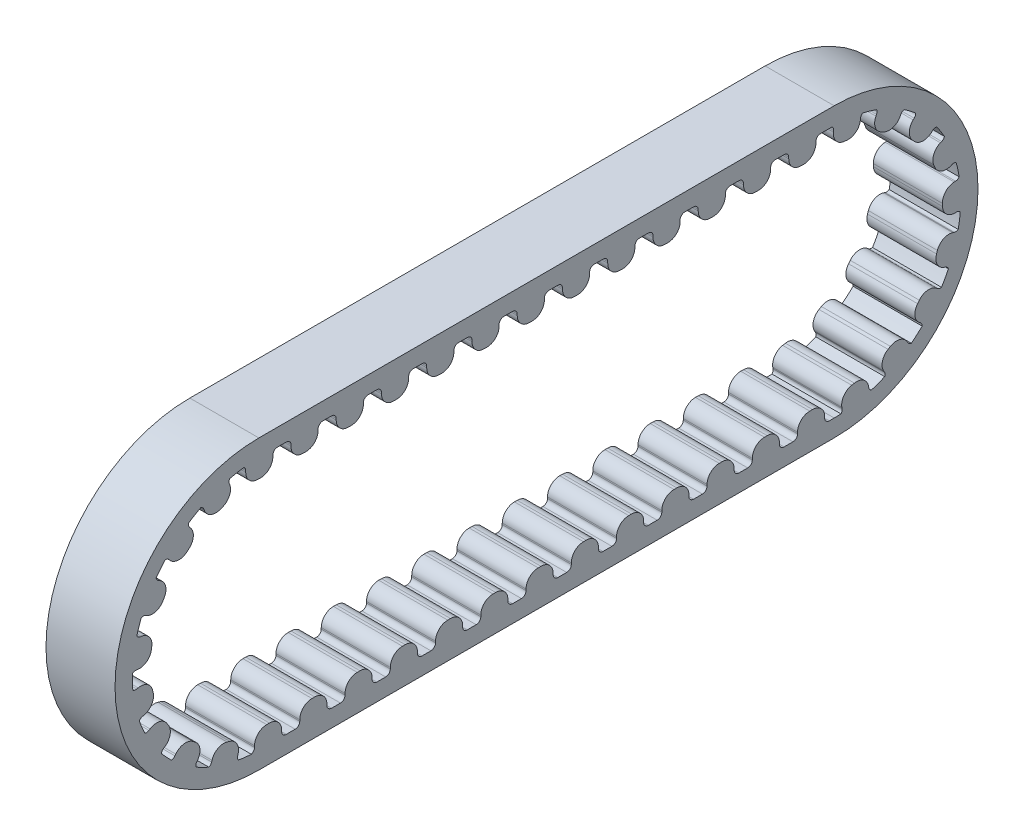
from build123d import *

# Parameters (mm, degrees)
BOSS_EXTRUDE1_DEPTH = 3
BOSS_EXTRUDE2_DEPTH = 3
CRVPATTERN1_DEPTH   = 3


# Read off the part's stored shape, not the designer's step: CrvPattern1
with BuildPart() as part:
    # Sketch1 → Boss-Extrude1 (new body)
    with BuildSketch(Plane(origin=(0, 0, 0), x_dir=(0, 0, -1), z_dir=(1, 0, 0))):
        with BuildLine():
            Line((0, 6.25), (25, 6.25))
            ThreePointArc((25, 6.25), (31.25, 0), (25, -6.25))
            Line((25, -6.25), (0, -6.25))
            ThreePointArc((0, -6.25), (-6.25, 0), (0, 6.25))
        make_face()
        with BuildLine():
            Line((0, 5.5), (25, 5.5))
            ThreePointArc((25, 5.5), (30.5, 0), (25, -5.5))
            Line((25, -5.5), (0, -5.5))
            ThreePointArc((0, -5.5), (-5.5, 0), (0, 5.5))
        make_face(mode=Mode.SUBTRACT)
    extrude(amount=BOSS_EXTRUDE1_DEPTH)

    # Sketch2 → Boss-Extrude2 (add)
    with BuildSketch(Plane(origin=(3, 0, 0), x_dir=(0, 0, -1), z_dir=(1, 0, 0))):
        with BuildLine():
            Line((1.39472131, 5.3), (1.39472131, 5.24))
            ThreePointArc((1.39472131, 5.24), (1.549954716, 4.865233406), (1.92472131, 4.71))
            Line((1.92472131, 4.71), (2.04472131, 4.71))
            ThreePointArc((2.04472131, 4.71), (2.419487904, 4.865233406), (2.57472131, 5.24))
            Line((2.57472131, 5.24), (2.57472131, 5.3))
            ThreePointArc((2.57472131, 5.3), (2.633299954, 5.441421356), (2.77472131, 5.5))
            ThreePointArc((2.77472131, 5.5), (1.98472131, 5.544721429), (1.19472131, 5.5))
            ThreePointArc((1.19472131, 5.5), (1.336142666, 5.441421356), (1.39472131, 5.3))
        make_face()
    extrude(amount=-BOSS_EXTRUDE2_DEPTH)

    # CrvPattern1 outline → CrvPattern1 (add)
    with BuildSketch(Plane.YZ):
        with BuildLine():
            ThreePointArc((5.24, 0.571732625), (4.865233406, 0.416499219), (4.71, 0.041732625))
            Line((4.71, 0.041732625), (4.71, -0.078267375))
            ThreePointArc((4.71, -0.078267375), (4.865233406, -0.453033969), (5.24, -0.608267375))
            Line((5.24, -0.608267375), (5.3, -0.608267375))
            ThreePointArc((5.3, -0.608267375), (5.441421356, -0.666846019), (5.5, -0.808267375))
            Line((5.5, -0.808267375), (5.5, 0))
            ThreePointArc((5.5, 0), (5.490260449, 0.327169987), (5.461076291, 0.65318125))
            ThreePointArc((5.461076291, 0.65318125), (5.390248892, 0.593252549), (5.3, 0.571732625))
            Line((5.3, 0.571732625), (5.24, 0.571732625))
        make_face()
        with BuildLine():
            ThreePointArc((5.3, -4.541175245), (5.441421357, -4.599753888), (5.5, -4.741175245))
            Line((5.5, -4.741175245), (5.5, -3.161175245))
            ThreePointArc((5.5, -3.161175245), (5.441421356, -3.302596601), (5.3, -3.361175245))
            Line((5.3, -3.361175245), (5.24, -3.361175245))
            ThreePointArc((5.24, -3.361175245), (4.865233406, -3.516408651), (4.71, -3.891175245))
            Line((4.71, -3.891175245), (4.71, -4.011175245))
            ThreePointArc((4.71, -4.011175245), (4.865233406, -4.385941839), (5.24, -4.541175245))
            Line((5.24, -4.541175245), (5.3, -4.541175245))
        make_face()
        with BuildLine():
            ThreePointArc((5.3, -6.507629179), (5.441421356, -6.566207823), (5.5, -6.707629179))
            Line((5.5, -6.707629179), (5.5, -5.127629179))
            ThreePointArc((5.5, -5.127629179), (5.441421357, -5.269050536), (5.3, -5.327629179))
            Line((5.3, -5.327629179), (5.24, -5.327629179))
            ThreePointArc((5.24, -5.327629179), (4.865233406, -5.482862585), (4.71, -5.857629179))
            Line((4.71, -5.857629179), (4.71, -5.977629179))
            ThreePointArc((4.71, -5.977629179), (4.865233406, -6.352395773), (5.24, -6.507629179))
            Line((5.24, -6.507629179), (5.3, -6.507629179))
        make_face()
        with BuildLine():
            ThreePointArc((5.3, -8.474083114), (5.441421356, -8.532661758), (5.5, -8.674083114))
            Line((5.5, -8.674083114), (5.5, -7.094083114))
            ThreePointArc((5.5, -7.094083114), (5.441421356, -7.23550447), (5.3, -7.294083114))
            Line((5.3, -7.294083114), (5.24, -7.294083114))
            ThreePointArc((5.24, -7.294083114), (4.865233406, -7.44931652), (4.71, -7.824083114))
            Line((4.71, -7.824083114), (4.71, -7.944083114))
            ThreePointArc((4.71, -7.944083114), (4.865233406, -8.318849708), (5.24, -8.474083114))
            Line((5.24, -8.474083114), (5.3, -8.474083114))
        make_face()
        with BuildLine():
            ThreePointArc((5.3, -10.440537049), (5.441421357, -10.499115693), (5.5, -10.640537049))
            Line((5.5, -10.640537049), (5.5, -9.060537049))
            ThreePointArc((5.5, -9.060537049), (5.441421356, -9.201958405), (5.3, -9.260537049))
            Line((5.3, -9.260537049), (5.24, -9.260537049))
            ThreePointArc((5.24, -9.260537049), (4.865233406, -9.415770455), (4.71, -9.790537049))
            Line((4.71, -9.790537049), (4.71, -9.910537049))
            ThreePointArc((4.71, -9.910537049), (4.865233406, -10.285303643), (5.24, -10.440537049))
            Line((5.24, -10.440537049), (5.3, -10.440537049))
        make_face()
        with BuildLine():
            ThreePointArc((5.3, -12.406990983), (5.441421356, -12.465569627), (5.5, -12.606990983))
            Line((5.5, -12.606990983), (5.5, -11.026990983))
            ThreePointArc((5.5, -11.026990983), (5.441421356, -11.168412339), (5.3, -11.226990983))
            Line((5.3, -11.226990983), (5.24, -11.226990983))
            ThreePointArc((5.24, -11.226990983), (4.865233406, -11.382224389), (4.71, -11.756990983))
            Line((4.71, -11.756990983), (4.71, -11.876990983))
            ThreePointArc((4.71, -11.876990983), (4.865233406, -12.251757577), (5.24, -12.406990983))
            Line((5.24, -12.406990983), (5.3, -12.406990983))
        make_face()
        with BuildLine():
            ThreePointArc((5.3, -14.373444918), (5.441421356, -14.432023562), (5.5, -14.573444918))
            Line((5.5, -14.573444918), (5.5, -12.993444918))
            ThreePointArc((5.5, -12.993444918), (5.441421356, -13.134866274), (5.3, -13.193444918))
            Line((5.3, -13.193444918), (5.24, -13.193444918))
            ThreePointArc((5.24, -13.193444918), (4.865233406, -13.348678324), (4.71, -13.723444918))
            Line((4.71, -13.723444918), (4.71, -13.843444918))
            ThreePointArc((4.71, -13.843444918), (4.865233406, -14.218211512), (5.24, -14.373444918))
            Line((5.24, -14.373444918), (5.3, -14.373444918))
        make_face()
        with BuildLine():
            ThreePointArc((5.3, -16.339898853), (5.441421356, -16.398477496), (5.5, -16.539898853))
            Line((5.5, -16.539898853), (5.5, -14.959898853))
            ThreePointArc((5.5, -14.959898853), (5.441421356, -15.101320209), (5.3, -15.159898853))
            Line((5.3, -15.159898853), (5.24, -15.159898853))
            ThreePointArc((5.24, -15.159898853), (4.865233405, -15.315132259), (4.71, -15.689898853))
            Line((4.71, -15.689898853), (4.71, -15.809898853))
            ThreePointArc((4.71, -15.809898853), (4.865233406, -16.184665447), (5.24, -16.339898853))
            Line((5.24, -16.339898853), (5.3, -16.339898853))
        make_face()
        with BuildLine():
            ThreePointArc((5.3, -18.306352787), (5.441421356, -18.364931431), (5.5, -18.506352787))
            Line((5.5, -18.506352787), (5.5, -16.926352787))
            ThreePointArc((5.5, -16.926352787), (5.441421356, -17.067774143), (5.3, -17.126352787))
            Line((5.3, -17.126352787), (5.24, -17.126352787))
            ThreePointArc((5.24, -17.126352787), (4.865233406, -17.281586193), (4.71, -17.656352787))
            Line((4.71, -17.656352787), (4.71, -17.776352787))
            ThreePointArc((4.71, -17.776352787), (4.865233406, -18.151119381), (5.24, -18.306352787))
            Line((5.24, -18.306352787), (5.3, -18.306352787))
        make_face()
        with BuildLine():
            ThreePointArc((5.3, -20.272806722), (5.441421356, -20.331385366), (5.5, -20.472806722))
            Line((5.5, -20.472806722), (5.5, -18.892806722))
            ThreePointArc((5.5, -18.892806722), (5.441421356, -19.034228078), (5.3, -19.092806722))
            Line((5.3, -19.092806722), (5.24, -19.092806722))
            ThreePointArc((5.24, -19.092806722), (4.865233406, -19.248040128), (4.71, -19.622806722))
            Line((4.71, -19.622806722), (4.71, -19.742806722))
            ThreePointArc((4.71, -19.742806722), (4.865233406, -20.117573316), (5.24, -20.272806722))
            Line((5.24, -20.272806722), (5.3, -20.272806722))
        make_face()
        with BuildLine():
            ThreePointArc((5.3, -22.239260656), (5.441421356, -22.2978393), (5.5, -22.439260656))
            Line((5.5, -22.439260656), (5.5, -20.859260656))
            ThreePointArc((5.5, -20.859260656), (5.441421356, -21.000682013), (5.3, -21.059260656))
            Line((5.3, -21.059260656), (5.24, -21.059260656))
            ThreePointArc((5.24, -21.059260656), (4.865233406, -21.214494062), (4.71, -21.589260656))
            Line((4.71, -21.589260656), (4.71, -21.709260656))
            ThreePointArc((4.71, -21.709260656), (4.865233406, -22.08402725), (5.24, -22.239260656))
            Line((5.24, -22.239260656), (5.3, -22.239260656))
        make_face()
        with BuildLine():
            ThreePointArc((5.3, -24.205714591), (5.441421356, -24.264293235), (5.5, -24.405714591))
            Line((5.5, -24.405714591), (5.5, -22.825714591))
            ThreePointArc((5.5, -22.825714591), (5.441421356, -22.967135947), (5.3, -23.025714591))
            Line((5.3, -23.025714591), (5.24, -23.025714591))
            ThreePointArc((5.24, -23.025714591), (4.865233406, -23.180947997), (4.71, -23.555714591))
            Line((4.71, -23.555714591), (4.71, -23.675714591))
            ThreePointArc((4.71, -23.675714591), (4.865233406, -24.050481185), (5.24, -24.205714591))
            Line((5.24, -24.205714591), (5.3, -24.205714591))
        make_face()
        with BuildLine():
            ThreePointArc((5.208002927, -26.146649691), (5.294135665, -26.176726755), (5.357948372, -26.241929643))
            ThreePointArc((5.357948372, -26.241929643), (5.464371695, -25.625013581), (5.5, -25))
            Line((5.5, -25), (5.5, -24.910850522))
            ThreePointArc((5.5, -24.910850522), (5.423687661, -24.961765723), (5.332671436, -24.973253866))
            Line((5.332671436, -24.973253866), (5.273007241, -24.966914789))
            ThreePointArc((5.273007241, -24.966914789), (4.883937517, -25.081684822), (4.689978345, -25.43795333))
            Line((4.689978345, -25.43795333), (4.677300192, -25.557281719))
            ThreePointArc((4.677300192, -25.557281719), (4.792070224, -25.946351443), (5.148338732, -26.140310615))
            Line((5.148338732, -26.140310615), (5.208002927, -26.146649691))
        make_face()
        with BuildLine():
            ThreePointArc((4.47736635, -27.896772439), (4.547526179, -27.955091191), (4.584484541, -28.038503167))
            ThreePointArc((4.584484541, -28.038503167), (4.919993096, -27.458387262), (5.182457978, -26.841773413))
            ThreePointArc((5.182457978, -26.841773413), (5.093564112, -26.86230044), (5.004802163, -26.841210284))
            Line((5.004802163, -26.841210284), (4.951129511, -26.814391514))
            ThreePointArc((4.951129511, -26.814391514), (4.546498077, -26.785741671), (4.240121949, -27.051600804))
            Line((4.240121949, -27.051600804), (4.186484409, -27.158946107))
            ThreePointArc((4.186484409, -27.158946107), (4.157834566, -27.56357754), (4.423693698, -27.869953669))
            Line((4.423693698, -27.869953669), (4.47736635, -27.896772439))
        make_face()
        with BuildLine():
            ThreePointArc((3.180446875, -29.280520724), (3.225760205, -29.359705195), (3.231189847, -29.450776581))
            ThreePointArc((3.231189847, -29.450776581), (3.748503458, -29.024763574), (4.210165676, -28.538997736))
            ThreePointArc((4.210165676, -28.538997736), (4.11970951, -28.527116647), (4.043941606, -28.476296346))
            Line((4.043941606, -28.476296346), (4.003048841, -28.432389835))
            ThreePointArc((4.003048841, -28.432389835), (3.634032181, -28.263943657), (3.253988563, -28.405768405))
            Line((3.253988563, -28.405768405), (3.16617554, -28.487553935))
            ThreePointArc((3.16617554, -28.487553935), (2.997729362, -28.856570595), (3.13955411, -29.236614213))
            Line((3.13955411, -29.236614213), (3.180446875, -29.280520724))
        make_face()
        with BuildLine():
            ThreePointArc((1.481274707, -30.122882513), (1.496010453, -30.212917707), (1.469224651, -30.300130086))
            ThreePointArc((1.469224651, -30.300130086), (2.102915155, -30.082100732), (2.705385158, -29.788621007))
            ThreePointArc((2.705385158, -29.788621007), (2.624807297, -29.745834484), (2.571616319, -29.671711625))
            Line((2.571616319, -29.671711625), (2.548675426, -29.616270526))
            ThreePointArc((2.548675426, -29.616270526), (2.261945579, -29.329332545), (1.856301168, -29.329185371))
            Line((1.856301168, -29.329185371), (1.74541897, -29.375067156))
            ThreePointArc((1.74541897, -29.375067156), (1.458480988, -29.661797002), (1.458333815, -30.067441414))
            Line((1.458333815, -30.067441414), (1.481274707, -30.122882513))
        make_face()
        with BuildLine():
            ThreePointArc((-0.405244323, -30.317318595), (-0.42294989, -30.406817149), (-0.478563354, -30.47914018))
            ThreePointArc((-0.478563354, -30.47914018), (0.191356906, -30.496670131), (0.858436225, -30.432594891))
            ThreePointArc((0.858436225, -30.432594891), (0.797927897, -30.364314435), (0.774041269, -30.27626384))
            Line((0.774041269, -30.27626384), (0.771953739, -30.216300166))
            ThreePointArc((0.771953739, -30.216300166), (0.603775375, -29.847161374), (0.22383477, -29.705060892))
            Line((0.22383477, -29.705060892), (0.103907422, -29.709235952))
            ThreePointArc((0.103907422, -29.709235952), (-0.265231371, -29.877414316), (-0.407331853, -30.257354921))
            Line((-0.407331853, -30.257354921), (-0.405244323, -30.317318595))
        make_face()
        with BuildLine():
            ThreePointArc((-2.240509354, -29.839237319), (-2.288416891, -29.916879745), (-2.365824205, -29.965166244))
            ThreePointArc((-2.365824205, -29.965166244), (-1.744403549, -30.216038368), (-1.097084962, -30.389471643))
            ThreePointArc((-1.097084962, -30.389471643), (-1.129870857, -30.304333148), (-1.121432031, -30.213491172))
            Line((-1.121432031, -30.213491172), (-1.102402175, -30.156588935))
            ThreePointArc((-1.102402175, -30.156588935), (-1.130758397, -29.751936819), (-1.43694153, -29.485855441))
            Line((-1.43694153, -29.485855441), (-1.550746003, -29.447795727))
            ThreePointArc((-1.550746003, -29.447795727), (-1.955398119, -29.47615195), (-2.221479497, -29.782335083))
            Line((-2.221479497, -29.782335083), (-2.240509354, -29.839237319))
        make_face()
        with BuildLine():
            ThreePointArc((-3.792401967, -28.749104869), (-3.864452282, -28.805071202), (-3.953863218, -28.823214048))
            ThreePointArc((-3.953863218, -28.823214048), (-3.459537453, -29.275698845), (-2.913850371, -29.664705352))
            ThreePointArc((-2.913850371, -29.664705352), (-2.914767179, -29.57347686), (-2.875070215, -29.491332905))
            Line((-2.875070215, -29.491332905), (-2.837329806, -29.444688917))
            ThreePointArc((-2.837329806, -29.444688917), (-2.722277484, -29.055702576), (-2.915978086, -28.699293419))
            Line((-2.915978086, -28.699293419), (-3.009266061, -28.623812602))
            ThreePointArc((-3.009266061, -28.623812602), (-3.398252402, -28.50876028), (-3.754661558, -28.702460882))
            Line((-3.754661558, -28.702460882), (-3.792401967, -28.749104869))
        make_face()
        with BuildLine():
            ThreePointArc((-4.864643774, -27.184797691), (-4.951724175, -27.212009489), (-5.041830325, -27.197714033))
            ThreePointArc((-5.041830325, -27.197714033), (-4.737120184, -27.794582681), (-4.362081354, -28.349962128))
            ThreePointArc((-4.362081354, -28.349962128), (-4.33101312, -28.264181926), (-4.265078762, -28.201125294))
            Line((-4.265078762, -28.201125294), (-4.213401088, -28.170638938))
            ThreePointArc((-4.213401088, -28.170638938), (-3.969491668, -27.846516114), (-4.02621111, -27.444856662))
            Line((-4.02621111, -27.444856662), (-4.087183823, -27.341501312))
            ThreePointArc((-4.087183823, -27.341501312), (-4.411306647, -27.097591892), (-4.812966099, -27.154311335))
            Line((-4.812966099, -27.154311335), (-4.864643774, -27.184797691))
        make_face()
        with BuildLine():
            ThreePointArc((-5.32162108, -25.344164327), (-5.412717919, -25.339179929), (-5.492122946, -25.294254214))
            ThreePointArc((-5.492122946, -25.294254214), (-5.415567187, -25.960016686), (-5.258610315, -26.611526467))
            ThreePointArc((-5.258610315, -26.611526467), (-5.19948645, -26.542043758), (-5.115653863, -26.506049651))
            Line((-5.115653863, -26.506049651), (-5.056574949, -26.495576741))
            ThreePointArc((-5.056574949, -26.495576741), (-4.714657311, -26.277311446), (-4.6272219, -25.881202295))
            Line((-4.6272219, -25.881202295), (-4.648167719, -25.763044466))
            ThreePointArc((-4.648167719, -25.763044466), (-4.866433014, -25.421126828), (-5.262542165, -25.333691417))
            Line((-5.262542165, -25.333691417), (-5.32162108, -25.344164327))
        make_face()
        with BuildLine():
            ThreePointArc((-5.3, -23.408505657), (-5.441421356, -23.349927014), (-5.5, -23.208505657))
            Line((-5.5, -23.208505657), (-5.5, -24.788505657))
            ThreePointArc((-5.5, -24.788505657), (-5.441421356, -24.647084301), (-5.3, -24.588505657))
            Line((-5.3, -24.588505657), (-5.24, -24.588505657))
            ThreePointArc((-5.24, -24.588505657), (-4.865233406, -24.433272251), (-4.71, -24.058505657))
            Line((-4.71, -24.058505657), (-4.71, -23.938505657))
            ThreePointArc((-4.71, -23.938505657), (-4.865233406, -23.563739063), (-5.24, -23.408505657))
            Line((-5.24, -23.408505657), (-5.3, -23.408505657))
        make_face()
        with BuildLine():
            ThreePointArc((-5.3, -21.442051723), (-5.441421356, -21.383473079), (-5.5, -21.242051723))
            Line((-5.5, -21.242051723), (-5.5, -22.822051723))
            ThreePointArc((-5.5, -22.822051723), (-5.441421357, -22.680630367), (-5.3, -22.622051723))
            Line((-5.3, -22.622051723), (-5.24, -22.622051723))
            ThreePointArc((-5.24, -22.622051723), (-4.865233406, -22.466818317), (-4.71, -22.092051723))
            Line((-4.71, -22.092051723), (-4.71, -21.972051723))
            ThreePointArc((-4.71, -21.972051723), (-4.865233406, -21.597285129), (-5.24, -21.442051723))
            Line((-5.24, -21.442051723), (-5.3, -21.442051723))
        make_face()
        with BuildLine():
            ThreePointArc((-5.3, -19.475597788), (-5.441421356, -19.417019144), (-5.5, -19.275597788))
            Line((-5.5, -19.275597788), (-5.5, -20.855597788))
            ThreePointArc((-5.5, -20.855597788), (-5.441421356, -20.714176432), (-5.3, -20.655597788))
            Line((-5.3, -20.655597788), (-5.24, -20.655597788))
            ThreePointArc((-5.24, -20.655597788), (-4.865233406, -20.500364382), (-4.71, -20.125597788))
            Line((-4.71, -20.125597788), (-4.71, -20.005597788))
            ThreePointArc((-4.71, -20.005597788), (-4.865233406, -19.630831194), (-5.24, -19.475597788))
            Line((-5.24, -19.475597788), (-5.3, -19.475597788))
        make_face()
        with BuildLine():
            ThreePointArc((-5.3, -17.509143853), (-5.441421357, -17.45056521), (-5.5, -17.309143853))
            Line((-5.5, -17.309143853), (-5.5, -18.889143853))
            ThreePointArc((-5.5, -18.889143853), (-5.441421356, -18.747722497), (-5.3, -18.689143853))
            Line((-5.3, -18.689143853), (-5.24, -18.689143853))
            ThreePointArc((-5.24, -18.689143853), (-4.865233406, -18.533910447), (-4.71, -18.159143853))
            Line((-4.71, -18.159143853), (-4.71, -18.039143853))
            ThreePointArc((-4.71, -18.039143853), (-4.865233406, -17.664377259), (-5.24, -17.509143853))
            Line((-5.24, -17.509143853), (-5.3, -17.509143853))
        make_face()
        with BuildLine():
            ThreePointArc((-5.3, -15.542689919), (-5.441421356, -15.484111275), (-5.5, -15.342689919))
            Line((-5.5, -15.342689919), (-5.5, -16.922689919))
            ThreePointArc((-5.5, -16.922689919), (-5.441421356, -16.781268562), (-5.3, -16.722689919))
            Line((-5.3, -16.722689919), (-5.24, -16.722689919))
            ThreePointArc((-5.24, -16.722689919), (-4.865233406, -16.567456513), (-4.71, -16.192689919))
            Line((-4.71, -16.192689919), (-4.71, -16.072689919))
            ThreePointArc((-4.71, -16.072689919), (-4.865233406, -15.697923325), (-5.24, -15.542689919))
            Line((-5.24, -15.542689919), (-5.3, -15.542689919))
        make_face()
        with BuildLine():
            ThreePointArc((-5.3, -13.576235984), (-5.441421356, -13.51765734), (-5.5, -13.376235984))
            Line((-5.5, -13.376235984), (-5.5, -14.956235984))
            ThreePointArc((-5.5, -14.956235984), (-5.441421356, -14.814814628), (-5.3, -14.756235984))
            Line((-5.3, -14.756235984), (-5.24, -14.756235984))
            ThreePointArc((-5.24, -14.756235984), (-4.865233406, -14.601002578), (-4.71, -14.226235984))
            Line((-4.71, -14.226235984), (-4.71, -14.106235984))
            ThreePointArc((-4.71, -14.106235984), (-4.865233406, -13.73146939), (-5.24, -13.576235984))
            Line((-5.24, -13.576235984), (-5.3, -13.576235984))
        make_face()
        with BuildLine():
            ThreePointArc((-5.3, -11.609782049), (-5.441421357, -11.551203406), (-5.5, -11.409782049))
            Line((-5.5, -11.409782049), (-5.5, -12.989782049))
            ThreePointArc((-5.5, -12.989782049), (-5.441421356, -12.848360693), (-5.3, -12.789782049))
            Line((-5.3, -12.789782049), (-5.24, -12.789782049))
            ThreePointArc((-5.24, -12.789782049), (-4.865233406, -12.634548643), (-4.71, -12.259782049))
            Line((-4.71, -12.259782049), (-4.71, -12.139782049))
            ThreePointArc((-4.71, -12.139782049), (-4.865233406, -11.765015455), (-5.24, -11.609782049))
            Line((-5.24, -11.609782049), (-5.3, -11.609782049))
        make_face()
        with BuildLine():
            ThreePointArc((-5.3, -9.643328115), (-5.441421356, -9.584749471), (-5.5, -9.443328115))
            Line((-5.5, -9.443328115), (-5.5, -11.023328115))
            ThreePointArc((-5.5, -11.023328115), (-5.441421356, -10.881906759), (-5.3, -10.823328115))
            Line((-5.3, -10.823328115), (-5.24, -10.823328115))
            ThreePointArc((-5.24, -10.823328115), (-4.865233406, -10.668094709), (-4.71, -10.293328115))
            Line((-4.71, -10.293328115), (-4.71, -10.173328115))
            ThreePointArc((-4.71, -10.173328115), (-4.865233406, -9.798561521), (-5.24, -9.643328115))
            Line((-5.24, -9.643328115), (-5.3, -9.643328115))
        make_face()
        with BuildLine():
            ThreePointArc((-5.3, -7.67687418), (-5.441421356, -7.618295536), (-5.5, -7.47687418))
            Line((-5.5, -7.47687418), (-5.5, -9.05687418))
            ThreePointArc((-5.5, -9.05687418), (-5.441421356, -8.915452824), (-5.3, -8.85687418))
            Line((-5.3, -8.85687418), (-5.24, -8.85687418))
            ThreePointArc((-5.24, -8.85687418), (-4.865233406, -8.701640774), (-4.71, -8.32687418))
            Line((-4.71, -8.32687418), (-4.71, -8.20687418))
            ThreePointArc((-4.71, -8.20687418), (-4.865233406, -7.832107586), (-5.24, -7.67687418))
            Line((-5.24, -7.67687418), (-5.3, -7.67687418))
        make_face()
        with BuildLine():
            ThreePointArc((-5.3, -5.710420246), (-5.441421356, -5.651841602), (-5.5, -5.510420246))
            Line((-5.5, -5.510420246), (-5.5, -7.090420246))
            ThreePointArc((-5.5, -7.090420246), (-5.441421357, -6.948998889), (-5.3, -6.890420246))
            Line((-5.3, -6.890420246), (-5.24, -6.890420246))
            ThreePointArc((-5.24, -6.890420246), (-4.865233406, -6.73518684), (-4.71, -6.360420246))
            Line((-4.71, -6.360420246), (-4.71, -6.240420246))
            ThreePointArc((-4.71, -6.240420246), (-4.865233405, -5.865653651), (-5.24, -5.710420246))
            Line((-5.24, -5.710420246), (-5.3, -5.710420246))
        make_face()
        with BuildLine():
            ThreePointArc((-5.3, -3.743966311), (-5.441421356, -3.685387667), (-5.5, -3.543966311))
            Line((-5.5, -3.543966311), (-5.5, -5.123966311))
            ThreePointArc((-5.5, -5.123966311), (-5.441421356, -4.982544955), (-5.3, -4.923966311))
            Line((-5.3, -4.923966311), (-5.24, -4.923966311))
            ThreePointArc((-5.24, -4.923966311), (-4.865233406, -4.768732905), (-4.71, -4.393966311))
            Line((-4.71, -4.393966311), (-4.71, -4.273966311))
            ThreePointArc((-4.71, -4.273966311), (-4.865233406, -3.899199717), (-5.24, -3.743966311))
            Line((-5.24, -3.743966311), (-5.3, -3.743966311))
        make_face()
        with BuildLine():
            ThreePointArc((-5.3, -1.777512376), (-5.441421356, -1.718933732), (-5.5, -1.577512376))
            Line((-5.5, -1.577512376), (-5.5, -3.157512376))
            ThreePointArc((-5.5, -3.157512376), (-5.441421356, -3.01609102), (-5.3, -2.957512376))
            Line((-5.3, -2.957512376), (-5.24, -2.957512376))
            ThreePointArc((-5.24, -2.957512376), (-4.865233406, -2.80227897), (-4.71, -2.427512376))
            Line((-4.71, -2.427512376), (-4.71, -2.307512376))
            ThreePointArc((-4.71, -2.307512376), (-4.865233406, -1.932745782), (-5.24, -1.777512376))
            Line((-5.24, -1.777512376), (-5.3, -1.777512376))
        make_face()
        with BuildLine():
            ThreePointArc((-5.3, 0.188941558), (-5.417613553, 0.227179226), (-5.490254427, 0.327271037))
            ThreePointArc((-5.490254427, 0.327271037), (-5.497563067, 0.163708054), (-5.5, 0))
            Line((-5.5, 0), (-5.5, -1.191058442))
            ThreePointArc((-5.5, -1.191058442), (-5.441421357, -1.049637085), (-5.3, -0.991058442))
            Line((-5.3, -0.991058442), (-5.24, -0.991058442))
            ThreePointArc((-5.24, -0.991058442), (-4.865233406, -0.835825036), (-4.71, -0.461058442))
            Line((-4.71, -0.461058442), (-4.71, -0.341058442))
            ThreePointArc((-4.71, -0.341058442), (-4.865233406, 0.033708152), (-5.24, 0.188941558))
            Line((-5.24, 0.188941558), (-5.3, 0.188941558))
        make_face()
        with BuildLine():
            ThreePointArc((-4.921110334, 2.054452015), (-5.00052217, 2.099365694), (-5.051723683, 2.17487651))
            ThreePointArc((-5.051723683, 2.17487651), (-5.278730401, 1.544346254), (-5.427367525, 0.890888177))
            ThreePointArc((-5.427367525, 0.890888177), (-5.343540396, 0.926894991), (-5.252442803, 0.921924402))
            Line((-5.252442803, 0.921924402), (-5.194856653, 0.905076988))
            ThreePointArc((-5.194856653, 0.905076988), (-4.791579209, 0.948834427), (-4.537360175, 1.264935824))
            Line((-4.537360175, 1.264935824), (-4.503665348, 1.380108124))
            ThreePointArc((-4.503665348, 1.380108124), (-4.547422787, 1.783385568), (-4.863524184, 2.037604602))
            Line((-4.863524184, 2.037604602), (-4.921110334, 2.054452015))
        make_face()
        with BuildLine():
            ThreePointArc((-3.890914504, 3.646763541), (-3.949586108, 3.716628562), (-3.97112334, 3.805283093))
            ThreePointArc((-3.97112334, 3.805283093), (-4.404440011, 3.294071673), (-4.772367063, 2.73395549))
            ThreePointArc((-4.772367063, 2.73395549), (-4.681239789, 2.738348468), (-4.597642609, 2.701810956))
            Line((-4.597642609, 2.701810956), (-4.549594172, 2.665875629))
            ThreePointArc((-4.549594172, 2.665875629), (-4.156505636, 2.565731666), (-3.807737592, 2.77287476))
            Line((-3.807737592, 2.77287476), (-3.735866937, 2.868971633))
            ThreePointArc((-3.735866937, 2.868971633), (-3.635722974, 3.262060169), (-3.842866068, 3.610828213))
            Line((-3.842866068, 3.610828213), (-3.890914504, 3.646763541))
        make_face()
        with BuildLine():
            ThreePointArc((-2.36860832, 4.77784414), (-2.399119095, 4.863824201), (-2.388268087, 4.954409707))
            ThreePointArc((-2.388268087, 4.954409707), (-2.973090212, 4.627173499), (-3.51377296, 4.231240904))
            ThreePointArc((-3.51377296, 4.231240904), (-3.426871026, 4.203464436), (-3.361347362, 4.139981149))
            Line((-3.361347362, 4.139981149), (-3.32891365, 4.089502893))
            ThreePointArc((-3.32891365, 4.089502893), (-2.995730597, 3.858123414), (-2.596524602, 3.930109412))
            Line((-2.596524602, 3.930109412), (-2.495568089, 3.994976835))
            ThreePointArc((-2.495568089, 3.994976835), (-2.26418861, 4.328159889), (-2.336174609, 4.727365884))
            Line((-2.336174609, 4.727365884), (-2.36860832, 4.77784414))
        make_face()
        with BuildLine():
            ThreePointArc((-0.546728172, 5.304638377), (-0.545219214, 5.395858996), (-0.503352367, 5.476918513))
            ThreePointArc((-0.503352367, 5.476918513), (-1.165713524, 5.3750453), (-1.810768153, 5.193372574))
            ThreePointArc((-1.810768153, 5.193372574), (-1.739082636, 5.136939738), (-1.699919709, 5.054539839))
            Line((-1.699919709, 5.054539839), (-1.687202835, 4.995902981))
            ThreePointArc((-1.687202835, 4.995902981), (-1.456065185, 4.662552119), (-1.05691153, 4.590276464))
            Line((-1.05691153, 4.590276464), (-0.939637814, 4.615710214))
            ThreePointArc((-0.939637814, 4.615710214), (-0.606286952, 4.846847864), (-0.534011298, 5.246001519))
            Line((-0.534011298, 5.246001519), (-0.546728172, 5.304638377))
        make_face()
        with BuildLine():
            ThreePointArc((1.344300397, 5.160519009), (1.37763824, 5.245442896), (1.445225743, 5.306724277))
            ThreePointArc((1.445225743, 5.306724277), (0.789098863, 5.443098656), (0.121256788, 5.498663182))
            ThreePointArc((0.121256788, 5.498663182), (0.168659334, 5.420711422), (0.176508321, 5.329816583))
            Line((0.176508321, 5.329816583), (0.16789997, 5.270437325))
            ThreePointArc((0.16789997, 5.270437325), (0.26775867, 4.877276226), (0.616376314, 4.66988011))
            Line((0.616376314, 4.66988011), (0.73513483, 4.652663407))
            ThreePointArc((0.73513483, 4.652663407), (1.12829593, 4.752522107), (1.335692045, 5.101139751))
            Line((1.335692045, 5.101139751), (1.344300397, 5.160519009))
        make_face()
        with BuildLine():
            ThreePointArc((3.065306174, 4.363713792), (3.126256439, 4.431600046), (3.211016348, 4.465352619))
            ThreePointArc((3.211016348, 4.465352619), (2.644108563, 4.822726398), (2.03794556, 5.108500553))
            ThreePointArc((2.03794556, 5.108500553), (2.055069813, 5.018888957), (2.030612147, 4.930995266))
            Line((2.030612147, 4.930995266), (2.001767326, 4.878383705))
            ThreePointArc((2.001767326, 4.878383705), (1.957717269, 4.475138119), (2.211706863, 4.158852336))
            Line((2.211706863, 4.158852336), (2.316929985, 4.101162694))
            ThreePointArc((2.316929985, 4.101162694), (2.720175571, 4.057112637), (3.036461353, 4.311102231))
            Line((3.036461353, 4.311102231), (3.065306174, 4.363713792))
        make_face()
        with BuildLine():
            ThreePointArc((4.398621884, 3.015000087), (4.479475777, 3.057262673), (4.57068793, 3.059217522))
            ThreePointArc((4.57068793, 3.059217522), (4.164699914, 3.592391213), (3.696881531, 4.0722312))
            ThreePointArc((3.696881531, 4.0722312), (3.681561671, 3.982293554), (3.627890678, 3.908517523))
            Line((3.627890678, 3.908517523), (3.582457588, 3.869327801))
            ThreePointArc((3.582457588, 3.869327801), (3.400070083, 3.506998933), (3.527307841, 3.121826292))
            Line((3.527307841, 3.121826292), (3.605687285, 3.030960112))
            ThreePointArc((3.605687285, 3.030960112), (3.968016153, 2.848572607), (4.353188794, 2.975810364))
            Line((4.353188794, 2.975810364), (4.398621884, 3.015000087))
        make_face()
        with BuildLine():
            ThreePointArc((5.175614042, 1.284958866), (5.266145423, 1.296252548), (5.352273601, 1.266162429))
            ThreePointArc((5.352273601, 1.266162429), (5.158553413, 1.907701939), (4.888247813, 2.520919141))
            ThreePointArc((4.888247813, 2.520919141), (4.842421448, 2.442030469), (4.766325263, 2.391703052))
            Line((4.766325263, 2.391703052), (4.710050134, 2.370891759))
            ThreePointArc((4.710050134, 2.370891759), (4.412392967, 2.095305799), (4.396786265, 1.689961697))
            Line((4.396786265, 1.689961697), (4.438408853, 1.577411441))
            ThreePointArc((4.438408853, 1.577411441), (4.713994812, 1.279754273), (5.119338914, 1.264147572))
            Line((5.119338914, 1.264147572), (5.175614042, 1.284958866))
        make_face()
    extrude(amount=CRVPATTERN1_DEPTH)


solid = part.part
